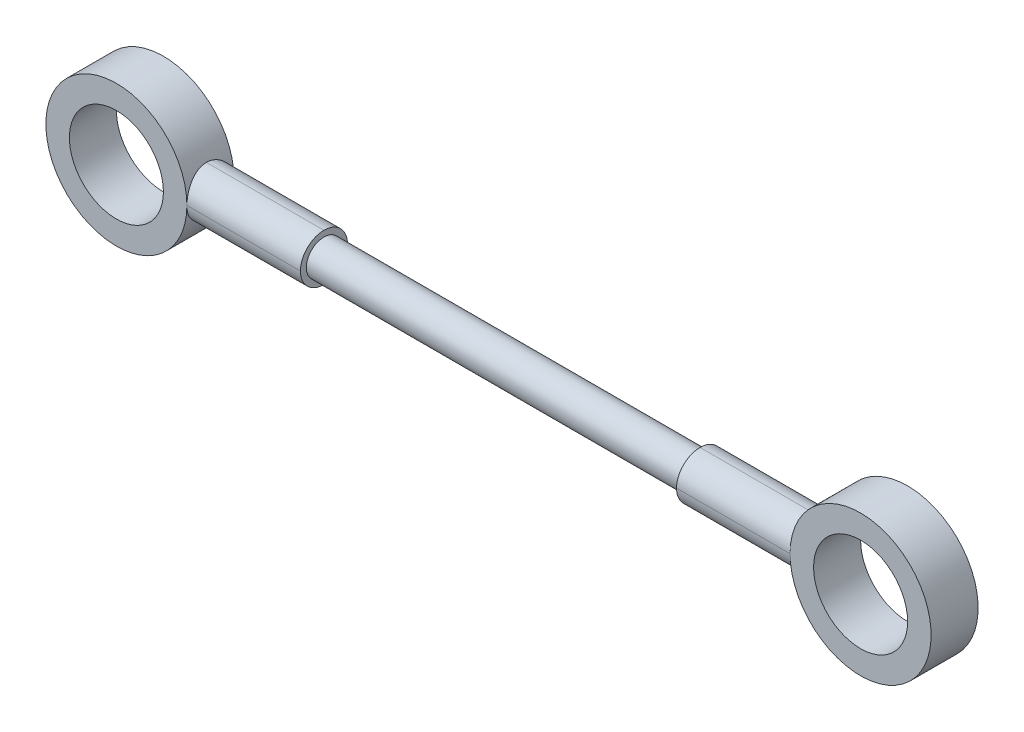
from build123d import *

# Parameters (mm, degrees)
EXTRUDE_1_DEPTH     = 2
SKETCH_3_R          = 0.75
EXTRUDE_2_DEPTH     = 20
SKETCH_6_R          = 2
CUT_EXTRUDE_1_DEPTH = 20
SKETCH_7_R          = 2
CUT_EXTRUDE_2_DEPTH = 20
FILLET_2_R          = 1
FILLET_3_R          = 1


with BuildPart() as part:
    # 草图2 → 凸台-拉伸1 (new body)
    with BuildSketch(Plane.XY):
        with BuildLine():
            Line((0, 0), (5, 0))
            Line((5, 0), (5, -2))
            Line((5, -2), (0, -2))
            ThreePointArc((0, -2), (-5.828427125, -1), (0, 0))
        make_face()
    extrude_1 = extrude(amount=EXTRUDE_1_DEPTH)

    # 草图3 → 凸台-拉伸2 (add)
    with BuildSketch(Plane(origin=(5, 0, 0), x_dir=(0, 0, -1), z_dir=(1, 0, 0))):
        with Locations((-1, -1)):
            Circle(SKETCH_3_R)
    extrude(amount=EXTRUDE_2_DEPTH)

    # 草图6 → 切除-拉伸1 (cut)
    with BuildSketch(Plane.XY.offset(2)):
        with Locations((-2.828427125, -1)):
            Circle(SKETCH_6_R)
    extrude(amount=-CUT_EXTRUDE_1_DEPTH, mode=Mode.SUBTRACT)

    # 镜向9: 凸台-拉伸1 across plane
    add(extrude_1.mirror(Plane(origin=(13, 0, 0), x_dir=(0, 0, 1), z_dir=(1, 0, 0))))

    # 草图7 → 切除-拉伸2 (cut)
    with BuildSketch(Plane(origin=(0, 0, 0), x_dir=(-1, 0, 0), z_dir=(0, 0, -1))):
        with Locations((-28.828427125, -1)):
            Circle(SKETCH_7_R)
    extrude(amount=-CUT_EXTRUDE_2_DEPTH, mode=Mode.SUBTRACT)

    # 圆角2
    fillet_2_edges = [part.edges().sort_by_distance(p)[0] for p in [
        (2.5, -2, 2),
        (2.5, -2, 0),
        (2.5, 0, 0),
        (2.5, 0, 2),
    ]]
    fillet(fillet_2_edges, radius=FILLET_2_R - 0.0001)  # a hair under: the kernel refuses the full size

    # 圆角3
    fillet_3_edges = [part.edges().sort_by_distance(p)[0] for p in [
        (23.5, -2, 2),
        (23.5, -2, 0),
        (23.5, 0, 0),
        (23.5, 0, 2),
    ]]
    fillet(fillet_3_edges, radius=FILLET_3_R - 0.0001)  # a hair under: the kernel refuses the full size


solid = part.part
